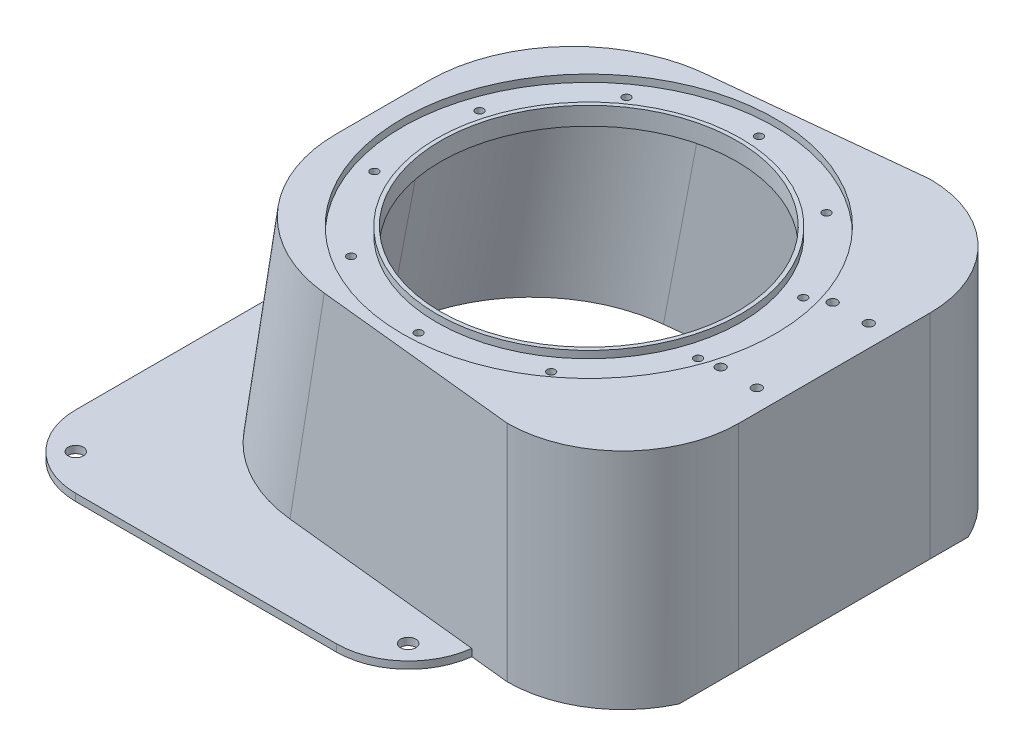
from build123d import *

# Parameters (mm, degrees)
EXTRUDE_1_DEPTH     = 60
EXTRUDE_2_DEPTH     = 2
SKETCH_3_R          = 53
EXTRUDE_3_DEPTH     = 3
SKETCH_4_R          = 51.6
CUT_EXTRUDE_1_DEPTH = 2
SKETCH_5_R          = 41
CUT_EXTRUDE_2_DEPTH = 108.917792787
EXTRUDE_START       = 2
SKETCH_6_R          = 42.1
SKETCH_6_R_2        = 41
EXTRUDE_4_DEPTH     = 2
SKETCH_9_W          = 24
SKETCH_9_H          = 47
EXTRUDE_6_DEPTH     = 9
SKETCH_10_W         = 24
SKETCH_10_H         = 37
CUT_EXTRUDE_6_DEPTH = 6
SKETCH_7_R          = 1.1
CUT_EXTRUDE_3_DEPTH = 108.917792787
CUT_EXTRUDE_7_REACH = 108.279
SKETCH_11_R         = 1.3
FILLET_2_R          = 4.5
CHAMFER_1_SIZE      = 62
CHAMFER_1_SIZE_2    = 10.932272804
FILLET_3_R          = 40
FILLET_4_R          = 32
CHAMFER_3_SIZE      = 3
EXTRUDE_7_DEPTH     = 2
FILLET_6_R          = 20
SKETCH_13_R         = 2.1
CUT_EXTRUDE_8_DEPTH = 131.529690109


# Some blends are built 0.0001 mm under size
with BuildPart() as part:
    # 스케치1 → 보스-돌출1 (new body)
    with BuildSketch(Plane(origin=(0, 0, 0), x_dir=(1, 0, 0), z_dir=(0, 1, 0))):
        Polygon((-68, -47.70428689), (35.844478487, -58.5), (68, -58.5), (68, 58.5), (35.844478487, 58.5), (-68, 47.70428689), align=None)
        Polygon((-65, -45), (36, -55.5), (65, -55.5), (65, 55.5), (36, 55.5), (-65, 45), align=None, mode=Mode.SUBTRACT)
    extrude(amount=EXTRUDE_1_DEPTH)

    # 스케치2 → 보스-돌출2 (add)
    with BuildSketch(Plane(origin=(0, 60, 0), x_dir=(1, 0, 0), z_dir=(0, 1, 0))):
        Polygon((-68, 47.70428689), (35.844478487, 58.5), (68, 58.5), (68, -58.5), (35.844478487, -58.5), (-68, -47.70428689), align=None)
    extrude(amount=EXTRUDE_2_DEPTH)

    # 스케치3 → 보스-돌출3 (add)
    with BuildSketch(Plane.XZ.offset(-60)):
        Circle(SKETCH_3_R)
    extrude(amount=EXTRUDE_3_DEPTH)

    # 스케치4 → 컷-돌출1 (cut)
    with BuildSketch(Plane(origin=(0, 62, 0), x_dir=(1, 0, 0), z_dir=(0, 1, 0))):
        with Locations(Location((0, 0, 0), (0, 0, 270))):
            Circle(SKETCH_4_R)
    extrude(amount=-CUT_EXTRUDE_1_DEPTH, mode=Mode.SUBTRACT)

    # 스케치5 → 컷-돌출2 (cut, through all)
    with BuildSketch(Plane(origin=(0, 60, 0), x_dir=(1, 0, 0), z_dir=(0, 1, 0))):
        with Locations(Location((0, 0, 0), (0, 0, 270))):
            Circle(SKETCH_5_R)
    extrude(amount=-CUT_EXTRUDE_2_DEPTH, mode=Mode.SUBTRACT)

    # 스케치6 → 보스-돌출4 (add)
    with BuildSketch(Plane(origin=(0, 60, 0), x_dir=(1, 0, 0), z_dir=(0, 1, 0)).offset(EXTRUDE_START)):
        with Locations(Location((0, 0, 0), (0, 0, 270))):
            Circle(SKETCH_6_R)
        with Locations(Location((0, 0, 0), (0, 0, 270))):
            Circle(SKETCH_6_R_2, mode=Mode.SUBTRACT)
    extrude(amount=-EXTRUDE_4_DEPTH)

    # 스케치9 → 보스-돌출6 (add)
    with BuildSketch(Plane.XZ.offset(-60)):
        with Locations((53, 0)):
            Rectangle(SKETCH_9_W, SKETCH_9_H)
    extrude(amount=EXTRUDE_6_DEPTH)

    # 스케치10 → 컷-돌출6 (cut)
    with BuildSketch(Plane.XZ.offset(-51)):
        with Locations((53, 0)):
            Rectangle(SKETCH_10_W, SKETCH_10_H)
    extrude(amount=-CUT_EXTRUDE_6_DEPTH, mode=Mode.SUBTRACT)

    # 스케치7 → 컷-돌출3 (cut, through all)
    with BuildSketch(Plane(origin=(0, 60, 0), x_dir=(1, 0, 0), z_dir=(0, 1, 0))):
        with Locations(Location((0, 47.1, 0), (0, 0, 270))):
            Circle(SKETCH_7_R)
        with Locations(Location((27.684685383, 38.104700435, 0), (0, 0, 270))):
            Circle(SKETCH_7_R)
        with Locations(Location((44.794761918, 14.554700435, 0), (0, 0, 270))):
            Circle(SKETCH_7_R)
        with Locations(Location((44.794761918, -14.554700435, 0), (0, 0, 270))):
            Circle(SKETCH_7_R)
        with Locations(Location((27.684685383, -38.104700435, 0), (0, 0, 270))):
            Circle(SKETCH_7_R)
        with Locations(Location((0, -47.1, 0), (0, 0, 270))):
            Circle(SKETCH_7_R)
        with Locations(Location((-27.684685383, -38.104700435, 0), (0, 0, 270))):
            Circle(SKETCH_7_R)
        with Locations(Location((-44.794761918, -14.554700435, 0), (0, 0, 270))):
            Circle(SKETCH_7_R)
        with Locations(Location((-44.794761918, 14.554700435, 0), (0, 0, 270))):
            Circle(SKETCH_7_R)
        with Locations(Location((-27.684685383, 38.104700435, 0), (0, 0, 270))):
            Circle(SKETCH_7_R)
    extrude(amount=-CUT_EXTRUDE_3_DEPTH, mode=Mode.SUBTRACT)

    # 스케치11 → 컷-돌출7 (cut, up to next)
    with BuildSketch(Plane.XZ.offset(-57), mode=Mode.PRIVATE) as cut_extrude_7_sk1:
        with Locations(Location((52, 15.5, 0), (0, 0, 270))):
            Circle(SKETCH_11_R)
    cut_extrude_7_tool1 = extrude(cut_extrude_7_sk1.sketch, amount=-CUT_EXTRUDE_7_REACH, mode=Mode.PRIVATE) & part.part
    # 스케치11 → 컷-돌출7 (cut, up to next)
    with BuildSketch(Plane.XZ.offset(-57), mode=Mode.PRIVATE) as cut_extrude_7_sk2:
        with Locations(Location((52, -15.5, 0), (0, 0, 270))):
            Circle(SKETCH_11_R)
    cut_extrude_7_tool2 = extrude(cut_extrude_7_sk2.sketch, amount=-CUT_EXTRUDE_7_REACH, mode=Mode.PRIVATE) & part.part
    # 스케치11 → 컷-돌출7 (cut, up to next)
    with BuildSketch(Plane.XZ.offset(-57), mode=Mode.PRIVATE) as cut_extrude_7_sk3:
        with Locations(Location((62, 15.5, 0), (0, 0, 270))):
            Circle(SKETCH_11_R)
    cut_extrude_7_tool3 = extrude(cut_extrude_7_sk3.sketch, amount=-CUT_EXTRUDE_7_REACH, mode=Mode.PRIVATE) & part.part
    # 스케치11 → 컷-돌출7 (cut, up to next)
    with BuildSketch(Plane.XZ.offset(-57), mode=Mode.PRIVATE) as cut_extrude_7_sk4:
        with Locations(Location((62, -15.5, 0), (0, 0, 270))):
            Circle(SKETCH_11_R)
    cut_extrude_7_tool4 = extrude(cut_extrude_7_sk4.sketch, amount=-CUT_EXTRUDE_7_REACH, mode=Mode.PRIVATE) & part.part
    add(cut_extrude_7_tool1.solids().sort_by_distance((52, 57, 15.5))[0], mode=Mode.SUBTRACT)
    add(cut_extrude_7_tool2.solids().sort_by_distance((52, 57, -15.5))[0], mode=Mode.SUBTRACT)
    add(cut_extrude_7_tool3.solids().sort_by_distance((62, 57, 15.5))[0], mode=Mode.SUBTRACT)
    add(cut_extrude_7_tool4.solids().sort_by_distance((62, 57, -15.5))[0], mode=Mode.SUBTRACT)

    # 필렛2
    fillet_2_edges = [part.edges().sort_by_distance(p)[0] for p in [
        (53, 51, 23.5),
        (53, 51, -23.5),
        (56.252631433, 60, -23.5),
        (56.252631433, 60, 23.5),
    ]]
    fillet(fillet_2_edges, radius=FILLET_2_R - 0.0001)  # a hair under: the kernel refuses the full size

    # 모따기1
    # the kernel refuses this chamfer: 62, 10.932272804 mm, written as the material it adds along each edge
    with BuildSketch(Plane(origin=(-65, 60, -206.109405378), x_dir=(0, -1, 0), z_dir=(0, 0, 1))) as chamfer_1_piece_1_section:
        Polygon((CHAMFER_1_SIZE, 0), (0, CHAMFER_1_SIZE_2), (0, 0), align=None)
    chamfer_1_piece_1 = extrude(amount=412.218810756, mode=Mode.PRIVATE)
    chamfer_1_piece_1 = split(chamfer_1_piece_1, bisect_by=Plane(origin=(-65, 0, -206.109405378), z_dir=(0, 1, 0)), keep=Keep.TOP, mode=Mode.PRIVATE)
    chamfer_1_piece_1 = split(chamfer_1_piece_1, bisect_by=Plane(origin=(-90.826308586, 60, 42.315086731), z_dir=(0.10340311946828108, 0, -0.9946395301234656)), keep=Keep.TOP, mode=Mode.PRIVATE)
    chamfer_1_piece_1 = split(chamfer_1_piece_1, bisect_by=Plane(origin=(-48.430086129, 60, -46.722614808), z_dir=(0.10340311946828099, 0, 0.9946395301234656)), keep=Keep.TOP, mode=Mode.PRIVATE)
    add(chamfer_1_piece_1)
    # the kernel refuses this chamfer: 62, 10.932272804 mm, written as the material it takes off along each edge
    with BuildSketch(Plane(origin=(-68, 62, 208.813692268), x_dir=(0, -1, 0), z_dir=(0, 0, -1))) as chamfer_1_2_piece_1:
        Polygon((CHAMFER_1_SIZE, 0), (0, -CHAMFER_1_SIZE_2), (0, 0), align=None)
    extrude(amount=417.627384536, mode=Mode.SUBTRACT)

    # 필렛3
    fillet_3_edges = [part.edges().sort_by_distance(p)[0] for p in [
        (-59.357536617, 30, 45.586592728),
        (-59.357536617, 30, -45.586592728),
        (-62.533863598, 31, -48.272548595),
        (-62.533863598, 31, 48.272548595),
    ]]
    fillet(fillet_3_edges, radius=FILLET_3_R)

    # 필렛4
    # the kernel refuses this fillet: 32 mm, written as the material it adds along each edge
    with BuildSketch(Plane(origin=(65, 0, -55.5), x_dir=(-1, 0, 0), z_dir=(0, 1, 0))) as fillet_4_piece_1_section:
        with BuildLine():
            CenterArc((32, 31.859064644), FILLET_4_R, 180, 84.620621009)
            Line((0, 31.859064644), (0, 0))
            Line((0, 0), (29, 0))
        make_face()
    fillet_4_piece_1 = extrude(amount=139.64766161, mode=Mode.PRIVATE)
    fillet_4_piece_1 = split(fillet_4_piece_1, bisect_by=Plane(origin=(65, 62, -55.5), z_dir=(0, -1, 0)), keep=Keep.TOP, mode=Mode.PRIVATE)
    add(fillet_4_piece_1)
    with BuildSketch(Plane(origin=(65, 0, 55.5), x_dir=(-1, 0, 0), z_dir=(0, 1, 0))) as fillet_4_piece_2_section:
        with BuildLine():
            CenterArc((32, -31.859064644), FILLET_4_R, 95.379378991, 84.620621009)
            Line((0, -31.859064644), (0, 0))
            Line((0, 0), (29, 0))
        make_face()
    fillet_4_piece_2 = extrude(amount=139.64766161, mode=Mode.PRIVATE)
    fillet_4_piece_2 = split(fillet_4_piece_2, bisect_by=Plane(origin=(65, 62, 55.5), z_dir=(0, -1, 0)), keep=Keep.TOP, mode=Mode.PRIVATE)
    add(fillet_4_piece_2)
    # the kernel refuses this fillet: 32 mm, written as the material it takes off along each edge
    with BuildSketch(Plane(origin=(68, -80, -58.5), x_dir=(0, 0, 1), z_dir=(0, 1, 0)), Plane(origin=(68, -80, 58.5), x_dir=(-1, 0, 0), z_dir=(0, 1, 0))) as fillet_4_2_piece_1:
        with BuildLine():
            CenterArc((FILLET_4_R, -FILLET_4_R), FILLET_4_R, 90, 90)
            Line((0, -FILLET_4_R), (0, 0))
            Line((0, 0), (FILLET_4_R, 0))
        make_face()
    extrude(amount=222, mode=Mode.SUBTRACT)

    # 모따기3
    # the kernel refuses this chamfer: 3 mm, written as the material it takes off along each edge
    with BuildSketch(Plane(origin=(68, 0, 49.645146892), x_dir=(-1, 0, 0), z_dir=(0, 0, -1))) as chamfer_3_piece_1:
        Polygon((CHAMFER_3_SIZE, 0), (0, CHAMFER_3_SIZE), (0, 0), align=None)
    extrude(amount=99.290293783, mode=Mode.SUBTRACT)

    # 스케치12 → 보스-돌출7 (add)
    with BuildSketch(Plane.XZ):
        with BuildLine():
            Line((-87, 75), (25, 75))
            Line((25, 75), (25, 54.356435644))
            Line((25, 54.356435644), (-31.208850945, 48.512941238))
            add(Edge.make_bspline(
                [(-65, 11.583952676), (-65, 13.84593004), (-64.788605397, 16.108697342), (-63.949844116, 20.560436525), (-63.322488488, 22.749328992), (-61.672367113, 26.980036242), (-60.649626077, 29.021772405), (-58.242511909, 32.889512361), (-56.858178216, 34.715440766), (-53.773914217, 38.08985885), (-52.074038344, 39.63827974), (-48.415574724, 42.405101268), (-46.457055415, 43.623443472), (-42.347190638, 45.688574053), (-40.1959253, 46.535317863), (-35.773216414, 47.828324294), (-33.501861283, 48.274558976), (-31.208850945, 48.512941238)],
                knots=[0, 0, 0, 0, 0.125, 0.125, 0.25, 0.25, 0.375, 0.375, 0.5, 0.5, 0.625, 0.625, 0.75, 0.75, 0.875, 0.875, 1, 1, 1, 1], degree=3))
            Line((-65, 11.583952676), (-65, -11.583952676))
            add(Edge.make_bspline(
                [(-31.208850945, -48.512941238), (-33.501861283, -48.274558976), (-35.773216414, -47.828324294), (-40.1959253, -46.535317863), (-42.347190638, -45.688574053), (-46.457055415, -43.623443472), (-48.415574724, -42.405101268), (-52.074038344, -39.63827974), (-53.773914217, -38.08985885), (-56.858178216, -34.715440766), (-58.242511909, -32.889512361), (-60.649626077, -29.021772405), (-61.672367113, -26.980036242), (-63.322488488, -22.749328992), (-63.949844116, -20.560436525), (-64.788605397, -16.108697342), (-65, -13.84593004), (-65, -11.583952676)],
                knots=[0, 0, 0, 0, 0.125, 0.125, 0.25, 0.25, 0.375, 0.375, 0.5, 0.5, 0.625, 0.625, 0.75, 0.75, 0.875, 0.875, 1, 1, 1, 1], degree=3))
            Line((-31.208850945, -48.512941238), (25, -54.356435644))
            Line((25, -54.356435644), (25, -75))
            Line((25, -75), (-87, -75))
            Line((-87, -75), (-87, 75))
        make_face()
    extrude(amount=-EXTRUDE_7_DEPTH)

    # 필렛6
    # the kernel refuses this fillet: 20 mm, written as the material it takes off along each edge
    with BuildSketch(Plane(origin=(25, -49.646925357, 75), x_dir=(-1, 0, 0), z_dir=(0, 1, 0))) as fillet_6_piece_1:
        with BuildLine():
            CenterArc((19.858770143, -20), FILLET_6_R, 90, 83.186946676)
            Line((0, -17.627396278), (-0.397175403, -17.579944204))
            ThreePointArc((-0.397175403, -17.579944204), (-0.4, -8.813698139), (-0.4, 0))
            Line((-0.4, 0), (0, 0.4))
            Line((0, 0.4), (19.858770143, 0.4))
            Line((19.858770143, 0.4), (19.858770143, 0))
        make_face()
    extrude(amount=101.293850713, mode=Mode.SUBTRACT)
    with BuildSketch(Plane(origin=(-87, -50, 75), x_dir=(1, 0, 0), z_dir=(0, 1, 0))) as fillet_6_piece_2:
        with BuildLine():
            CenterArc((FILLET_6_R, FILLET_6_R), FILLET_6_R, 180, 90)
            Line((0, FILLET_6_R), (-FILLET_6_R * 0.02, FILLET_6_R))
            Line((-FILLET_6_R * 0.02, FILLET_6_R), (-FILLET_6_R * 0.02, -FILLET_6_R * 0.02))
            Line((-FILLET_6_R * 0.02, -FILLET_6_R * 0.02), (FILLET_6_R, -FILLET_6_R * 0.02))
            Line((FILLET_6_R, -FILLET_6_R * 0.02), (FILLET_6_R, 0))
        make_face()
    extrude(amount=102, mode=Mode.SUBTRACT)
    with BuildSketch(Plane(origin=(25, -49.646925357, -75), x_dir=(0, 0, 1), z_dir=(0, 1, 0))) as fillet_6_piece_3:
        with BuildLine():
            CenterArc((20, -19.858770143), FILLET_6_R, 96.813053324, 83.186946676)
            Line((0, -19.858770143), (-0.4, -19.858770143))
            Line((-0.4, -19.858770143), (-0.4, 0))
            Line((-0.4, 0), (0, 0.4))
            ThreePointArc((0, 0.4), (8.813698139, 0.4), (17.579944204, 0.397175403))
            Line((17.579944204, 0.397175403), (17.627396278, 0))
        make_face()
    extrude(amount=101.293850713, mode=Mode.SUBTRACT)
    with BuildSketch(Plane(origin=(-87, -50, -75), x_dir=(1, 0, 0), z_dir=(0, 1, 0))) as fillet_6_piece_4:
        with BuildLine():
            CenterArc((FILLET_6_R, -FILLET_6_R), FILLET_6_R, 90, 90)
            Line((0, -FILLET_6_R), (-FILLET_6_R * 0.02, -FILLET_6_R))
            Line((-FILLET_6_R * 0.02, -FILLET_6_R), (-FILLET_6_R * 0.02, FILLET_6_R * 0.02))
            Line((-FILLET_6_R * 0.02, FILLET_6_R * 0.02), (FILLET_6_R, FILLET_6_R * 0.02))
            Line((FILLET_6_R, FILLET_6_R * 0.02), (FILLET_6_R, 0))
        make_face()
    extrude(amount=102, mode=Mode.SUBTRACT)

    # 스케치13 → 컷-돌출8 (cut, through all)
    with BuildSketch(Plane.XZ):
        with Locations(Location((-77, 65, 0), (0, 0, 270))):
            Circle(SKETCH_13_R)
        with Locations(Location((15, 65, 0), (0, 0, 270))):
            Circle(SKETCH_13_R)
        with Locations(Location((-75.4994928, -65, 0), (0, 0, 270))):
            Circle(SKETCH_13_R)
        with Locations(Location((15, -65, 0), (0, 0, 270))):
            Circle(SKETCH_13_R)
    extrude(amount=-CUT_EXTRUDE_8_DEPTH, mode=Mode.SUBTRACT)


solid = part.part
